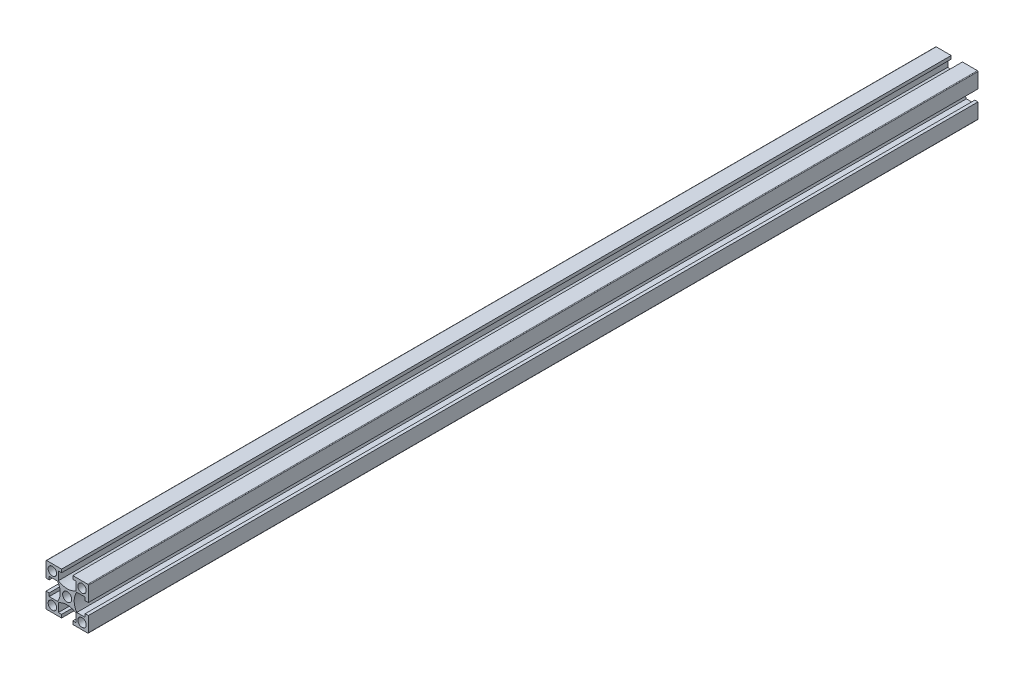
from build123d import *

# Parameters (mm, degrees)
SKETCH_1_W               = 20
SKETCH_1_H               = 20
SKETCH_1_R               = 2
SKETCH_1_R_2             = 2.15
EXTRUDE_1_DEPTH          = 420
CUT_EXTRUDE_1_REACH      = 422.238
PATTERN_CIRCULAR_1_COUNT = 4
FILLET_1_R               = 0.3
SKETCH_6_R               = 2.5
CUT_EXTRUDE_4_DEPTH      = 421.594816896
SKETCH_7_R               = 2.5
CUT_EXTRUDE_5_DEPTH      = 421.594816996
SKETCH_8_R               = 2.5
CUT_EXTRUDE_6_DEPTH      = 421.594816996


with BuildPart() as part:
    # 스케치1 → 보스-돌출1 (new body)
    with BuildSketch(Plane.XY):
        Rectangle(SKETCH_1_W, SKETCH_1_H)
        with Locations((-7, -7)):
            Circle(SKETCH_1_R, mode=Mode.SUBTRACT)
        with Locations((7, -7)):
            Circle(SKETCH_1_R, mode=Mode.SUBTRACT)
        with Locations((-7, 7)):
            Circle(SKETCH_1_R, mode=Mode.SUBTRACT)
        Circle(SKETCH_1_R_2, mode=Mode.SUBTRACT)
        with Locations((7, 7)):
            Circle(SKETCH_1_R, mode=Mode.SUBTRACT)
    extrude(amount=EXTRUDE_1_DEPTH)

    # 스케치1<3> → 컷-돌출1 (cut, up to next)
    with BuildSketch(Plane.XY, mode=Mode.PRIVATE) as cut_extrude_1_sk1:
        with BuildLine():
            Line((-8.5, 2.65), (-10, 2.65))
            Line((-10, 2.65), (-10, -2.65))
            Line((-10, -2.65), (-8.5, -2.65))
            Line((-8.5, -2.65), (-8.5, -4.15))
            Line((-8.5, -4.15), (-4.503166667, -4.15))
            ThreePointArc((-4.503166667, -4.15), (-3.3, 0), (-4.503166667, 4.15))
            Line((-4.503166667, 4.15), (-8.5, 4.15))
            Line((-8.5, 4.15), (-8.5, 2.65))
        make_face()
    cut_extrude_1_tool1 = extrude(cut_extrude_1_sk1.sketch, amount=CUT_EXTRUDE_1_REACH, mode=Mode.PRIVATE) & part.part
    cut_extrude_1 = cut_extrude_1_tool1.solids().sort_by_distance((-6.606913, 0, 0))[0]
    add(cut_extrude_1, mode=Mode.SUBTRACT)

    # 원형 패턴1: 컷-돌출1 ×4 about axis
    pattern_circular_1_axis = Axis((0, 0, 420), (0, 0, -1))
    for i in range(1, PATTERN_CIRCULAR_1_COUNT):
        add(cut_extrude_1.rotate(pattern_circular_1_axis, i * 360 / PATTERN_CIRCULAR_1_COUNT), mode=Mode.SUBTRACT)

    # 필렛1
    fillet_1_edges = [part.edges().sort_by_distance(p)[0] for p in [
        (10, -10, 210),
        (-10, -10, 210),
        (-10, 10, 210),
        (10, 10, 210),
    ]]
    fillet(fillet_1_edges, radius=FILLET_1_R)

    # 스케치6 → 컷-돌출4 (cut, through all)
    with BuildSketch(Plane(origin=(0, 10, 0), x_dir=(1, 0, 0), z_dir=(0, 1, 0))):
        with Locations((0, -110)):
            Circle(SKETCH_6_R)
        with Locations((0, -310)):
            Circle(SKETCH_6_R)
    extrude(amount=-CUT_EXTRUDE_4_DEPTH, mode=Mode.SUBTRACT)

    # 스케치7 → 컷-돌출5 (cut, through all)
    with BuildSketch(Plane.XZ.offset(10)):
        with Locations((0, 249.5)):
            Circle(SKETCH_7_R)
        with Locations((0, 170.5)):
            Circle(SKETCH_7_R)
    extrude(amount=-CUT_EXTRUDE_5_DEPTH, mode=Mode.SUBTRACT)

    # 스케치8 → 컷-돌출6 (cut, through all)
    with BuildSketch(Plane(origin=(10, 0, 0), x_dir=(0, 0, -1), z_dir=(1, 0, 0))):
        with Locations((-310, 0)):
            Circle(SKETCH_8_R)
        with Locations((-110, 0)):
            Circle(SKETCH_8_R)
    extrude(amount=-CUT_EXTRUDE_6_DEPTH, mode=Mode.SUBTRACT)


solid = part.part
